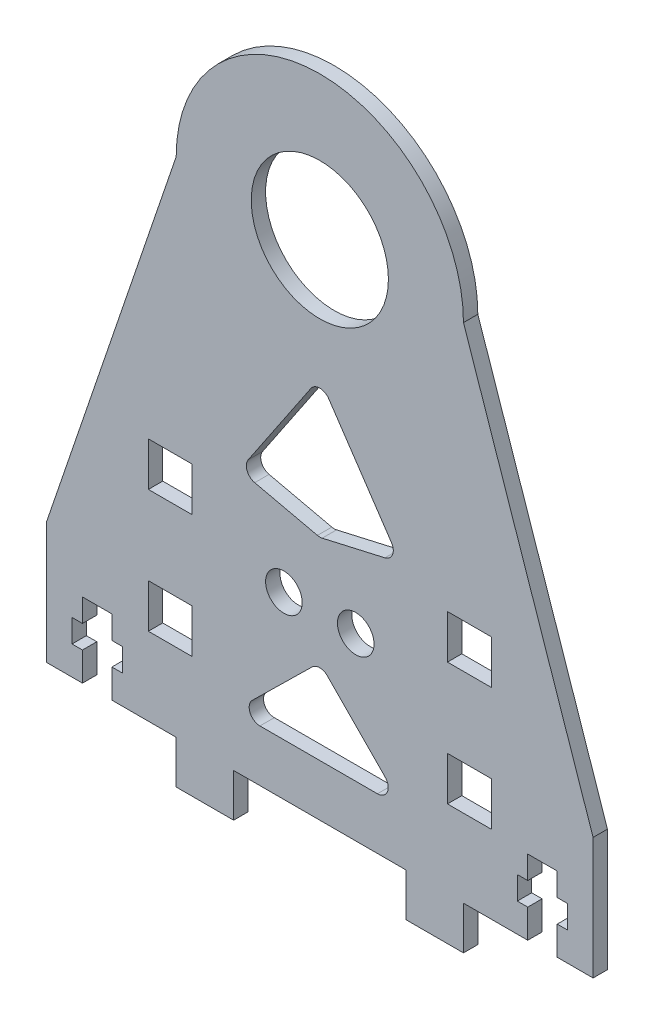
from build123d import *

# Parameters (mm, degrees)
SKETCH_1_R      = 9.55
SKETCH_1_R_2    = 2.55
SKETCH_1_W      = 6.1
SKETCH_1_H      = 6.1
EXTRUDE_1_DEPTH = 2
FILLET_3_R      = 1.5


with BuildPart() as part:
    # 草图1 → 凸台-拉伸1 (new body)
    with BuildSketch(Plane.XY):
        with BuildLine():
            Line((-28.741188564, 3.13029316), (-28.741188564, 7.13029316))
            Line((-28.741188564, 7.13029316), (-27.291188564, 7.13029316))
            Line((-27.291188564, 7.13029316), (-27.291188564, 10.33029316))
            Line((-27.291188564, 10.33029316), (-28.741188564, 10.33029316))
            Line((-28.741188564, 10.33029316), (-28.741188564, 13.53029316))
            Line((-28.741188564, 13.53029316), (-32.841188564, 13.53029316))
            Line((-32.841188564, 13.53029316), (-32.841188564, 10.33029316))
            Line((-32.841188564, 10.33029316), (-34.291188564, 10.33029316))
            Line((-34.291188564, 10.33029316), (-34.291188564, 7.13029316))
            Line((-34.291188564, 7.13029316), (-32.841188564, 7.13029316))
            Line((-32.841188564, 7.13029316), (-32.841188564, 3.13029316))
            Line((-32.841188564, 3.13029316), (-37.841188564, 3.13029316))
            Line((-37.841188564, 3.13029316), (-37.841188564, 20.08029316))
            Line((-37.841188564, 20.08029316), (-19.791188564, 73.13029316))
            ThreePointArc((-19.791188564, 73.13029316), (0.208811436, 93.13029316), (20.208811436, 73.13029316))
            Line((20.208811436, 73.13029316), (38.258811436, 20.08029316))
            Line((38.258811436, 20.08029316), (38.258811436, 3.13029316))
            Line((38.258811436, 3.13029316), (33.258811436, 3.13029316))
            Line((33.258811436, 3.13029316), (33.258811436, 7.13029316))
            Line((33.258811436, 7.13029316), (34.708811436, 7.13029316))
            Line((34.708811436, 7.13029316), (34.708811436, 10.33029316))
            Line((34.708811436, 10.33029316), (33.258811436, 10.33029316))
            Line((33.258811436, 10.33029316), (33.258811436, 13.53029316))
            Line((33.258811436, 13.53029316), (29.158811436, 13.53029316))
            Line((29.158811436, 13.53029316), (29.158811436, 10.33029316))
            Line((29.158811436, 10.33029316), (27.708811436, 10.33029316))
            Line((27.708811436, 10.33029316), (27.708811436, 7.13029316))
            Line((27.708811436, 7.13029316), (29.158811436, 7.13029316))
            Line((29.158811436, 7.13029316), (29.158811436, 3.13029316))
            Line((29.158811436, 3.13029316), (20.208811436, 3.13029316))
            Line((20.208811436, 3.13029316), (20.208811436, -2.86970684))
            Line((20.208811436, -2.86970684), (12.208811436, -2.86970684))
            Line((12.208811436, -2.86970684), (12.208811436, 3.13029316))
            Line((12.208811436, 3.13029316), (-11.791188564, 3.13029316))
            Line((-11.791188564, 3.13029316), (-11.791188564, -2.86970684))
            Line((-11.791188564, -2.86970684), (-19.791188564, -2.86970684))
            Line((-19.791188564, -2.86970684), (-19.791188564, 3.13029316))
            Line((-19.791188564, 3.13029316), (-28.741188564, 3.13029316))
        make_face()
        with Locations((0.208811436, 73.13029316)):
            Circle(SKETCH_1_R, mode=Mode.SUBTRACT)
        with Locations((-4.791188564, 28.13029316)):
            Circle(SKETCH_1_R_2, mode=Mode.SUBTRACT)
        with Locations((5.208811436, 28.13029316)):
            Circle(SKETCH_1_R_2, mode=Mode.SUBTRACT)
        with Locations((-20.612527992, 34.13029316)):
            Rectangle(SKETCH_1_W, SKETCH_1_H, mode=Mode.SUBTRACT)
        with Locations((-20.612527992, 17.03029316)):
            Rectangle(SKETCH_1_W, SKETCH_1_H, mode=Mode.SUBTRACT)
        Polygon((0.208811436, 22.13029316), (-11.791188564, 10.33029316), (11.812144769, 10.33029316), align=None, mode=Mode.SUBTRACT)
        with Locations((21.030150863, 34.13029316)):
            Rectangle(SKETCH_1_W, SKETCH_1_H, mode=Mode.SUBTRACT)
        with Locations((21.030150863, 17.03029316)):
            Rectangle(SKETCH_1_W, SKETCH_1_H, mode=Mode.SUBTRACT)
        Polygon((0.208811436, 56.417251186), (-10.987657951, 39.784470466), (0.208811436, 37.232850696), (11.405280822, 39.784470466), align=None, mode=Mode.SUBTRACT)
    extrude(amount=EXTRUDE_1_DEPTH)

    # 圆角3
    fillet_3_edges = [part.edges().sort_by_distance(p)[0] for p in [
        (11.812144769, 10.33029316, 1),
        (-11.791188564, 10.33029316, 1),
        (0.208811436, 22.13029316, 1),
        (0.208811436, 37.232850696, 1),
        (11.405280822, 39.784470466, 1),
        (-10.987657951, 39.784470466, 1),
        (0.208811436, 56.417251186, 1),
    ]]
    fillet(fillet_3_edges, radius=FILLET_3_R)


solid = part.part
